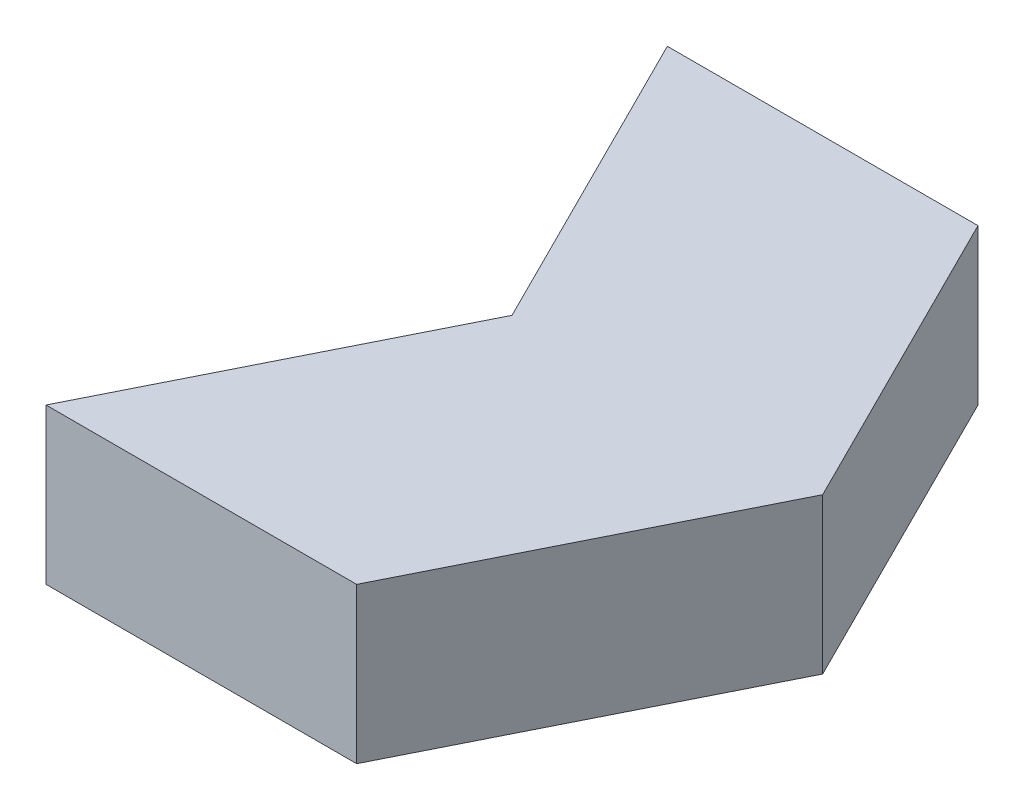
from build123d import *

# Parameters (mm, degrees)
BOSS_EXTRUDE1_DEPTH = 6.35
SKETCH2_R           = 5.127000033
CUT_EXTRUDE1_DEPTH  = 2.699999934
CUT_EXTRUDE2_DEPTH  = 2.699999934


with BuildPart() as part:
    # Sketch1 → Boss-Extrude1 (new body)
    with BuildSketch(Plane(origin=(0, 0, 0), x_dir=(1, 0, 0), z_dir=(0, 1, 0))):
        Polygon((0, 0), (12.7, 0), (19.05, 12.7), (12.7, 25.4), (0, 25.4), (6.35, 12.7), align=None)
    extrude(amount=BOSS_EXTRUDE1_DEPTH)

    # Sketch2 → Cut-Extrude1 (cut)
    with BuildSketch(Plane.XZ):
        with Locations((12.192, -12.7)):
            Circle(SKETCH2_R)
    extrude(amount=-CUT_EXTRUDE1_DEPTH, mode=Mode.SUBTRACT)

    # Sketch3 → Cut-Extrude2 (cut)
    with BuildSketch(Plane.XZ):
        Polygon((11.106516251, -17.710773829), (8.834671186, -16.574851297), (7.130787387, -19.982618895), (9.402632452, -21.118541427), align=None)
    extrude(amount=-CUT_EXTRUDE2_DEPTH, mode=Mode.SUBTRACT)


solid = part.part
